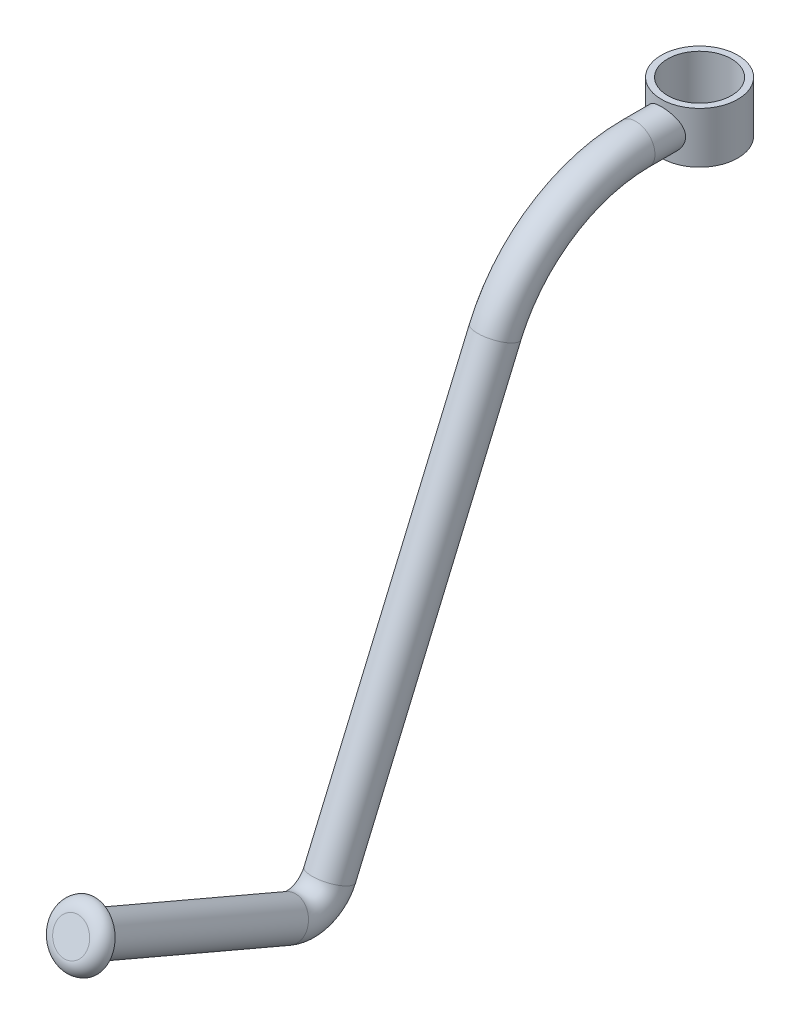
from build123d import *

# Parameters (mm, degrees)
SKETCH2_R                = 7.62
SKETCH4_R                = 11.950330427
BOSS_EXTRUDE1_DEPTH      = 5.08
FILLET1_R                = 5.08
BOSS_EXTRUDE2_DEPTH      = 10.16
BOSS_EXTRUDE2_DEPTH_BACK = 10.16
SKETCH5_R                = 15.24
SKETCH6_R                = 12.7
CUT_EXTRUDE1_DEPTH       = 335.141301153


with BuildPart() as part:
    # Sweep1: sweep along a path in Sketch1
    with BuildLine(Plane(origin=(0, 0, 0), x_dir=(0, 0, -1), z_dir=(1, 0, 0))) as sweep1_path:
        Line((-245.842907084, -163.312870299), (-164.080363385, -198.214108787))
        ThreePointArc((-164.080363385, -198.214108787), (-154.360765503, -198.318567045), (-147.414108787, -191.519636615))
        Line((-147.414108787, -191.519636615), (-81.467540759, -37.02772218))
        ThreePointArc((-81.467540759, -37.02772218), (-58.996512939, -10.092361683), (-25.401796509, 0))
        Line((-25.401796509, 0), (0, 0))
    # Sketch2 → Sweep1 (sweep)
    with BuildSketch(Plane.XY):
        Circle(SKETCH2_R)
    sweep(path=sweep1_path.line)

    # Sketch4 → Boss-Extrude1 (add)
    with BuildSketch(Plane(origin=(0, 63.595671041, 148.98450765), x_dir=(1, 0, 0), z_dir=(0, 0.39258985925704815, 0.9197136523986861))):
        with Locations(Location((0, -246.716508718, 0), (0, 0, 270))):
            Circle(SKETCH4_R)
    extrude(amount=BOSS_EXTRUDE1_DEPTH)

    # Fillet1
    fillet1_edges = [part.edges().sort_by_distance(p)[0] for p in [
        (0, -150.32763177, 245.823473898),
    ]]
    fillet(fillet1_edges, radius=FILLET1_R - 0.0001)  # a hair under: the kernel refuses the full size

    # Sketch5 → Boss-Extrude2 (add, two sides: drawn at the far end of the back side and taken through both)
    with BuildSketch(Plane(origin=(0, 0, 0), x_dir=(1, 0, 0), z_dir=(0, 1, 0)).offset(-BOSS_EXTRUDE2_DEPTH_BACK)):
        with Locations(Location((0, 0, 0), (0, 0, 270))):
            Circle(SKETCH5_R)
    extrude(amount=BOSS_EXTRUDE2_DEPTH + BOSS_EXTRUDE2_DEPTH_BACK)

    # Sketch6 → Cut-Extrude1 (cut, through all)
    with BuildSketch(Plane(origin=(0, 10.16, 0), x_dir=(1, 0, 0), z_dir=(0, 1, 0))):
        with Locations(Location((0, 0, 0), (0, 0, 270))):
            Circle(SKETCH6_R)
    extrude(amount=-CUT_EXTRUDE1_DEPTH, mode=Mode.SUBTRACT)


solid = part.part
